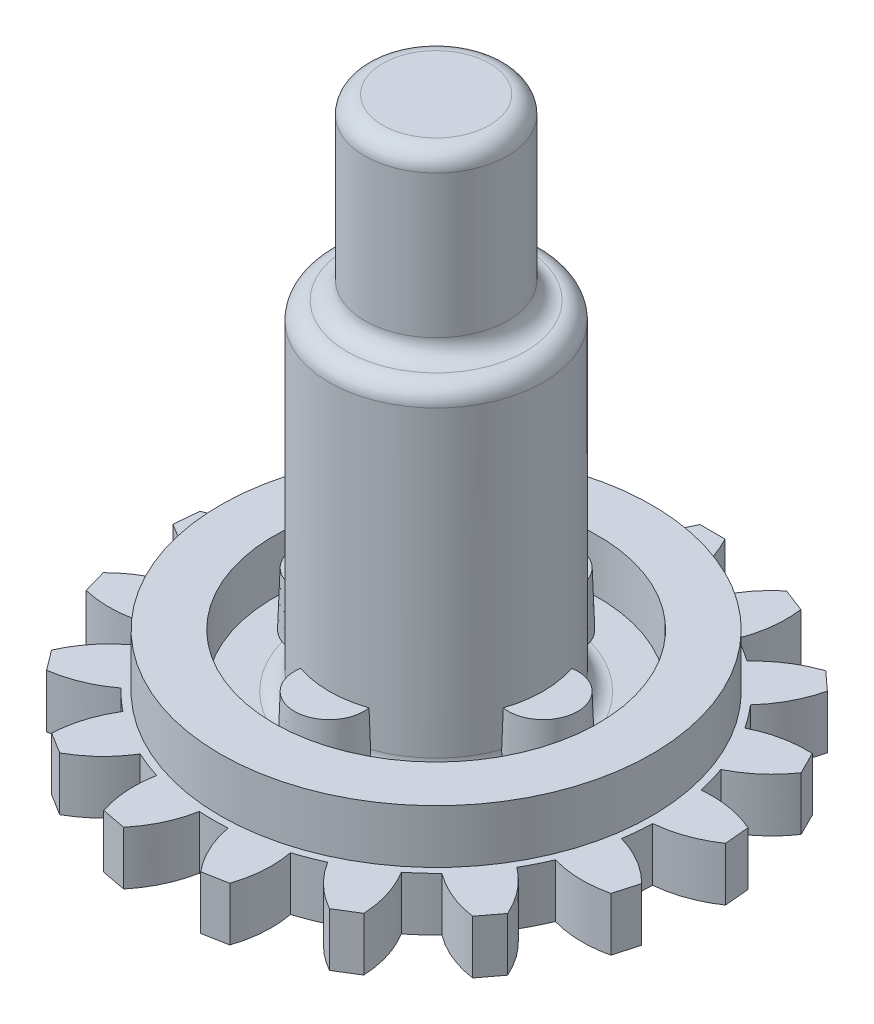
from build123d import *

# Parameters (mm, degrees)
SKETCH2_R                     = 8.9
BOSS_EXTRUDE1_DEPTH           = 1.5
SKETCH3_R                     = 12.1
SKETCH3_R_2                   = 9.1
BOSS_EXTRUDE2_DEPTH           = 3
SKETCH4_R                     = 8.9
BOSS_EXTRUDE3_DEPTH           = 3
SKETCH5_R                     = 2.05
BOSS_EXTRUDE4_DEPTH           = 3
BOSS_EXTRUDE4_DRAFT           = 2
BOSS_EXTRUDE4_PROFILE_2_DEPTH = 3
BOSS_EXTRUDE4_PROFILE_2_DRAFT = 2
BOSS_EXTRUDE4_PROFILE_3_DEPTH = 3
BOSS_EXTRUDE4_PROFILE_3_DRAFT = 2
BOSS_EXTRUDE4_PROFILE_4_DEPTH = 3
BOSS_EXTRUDE4_PROFILE_4_DRAFT = 2
SKETCH6_R                     = 6
BOSS_EXTRUDE5_DEPTH           = 19
SKETCH7_R                     = 4
BOSS_EXTRUDE6_DEPTH           = 10
FILLET1_R                     = 1


with BuildPart() as part:
    # Sketch2 → Boss-Extrude1 (new, symmetric)
    with BuildSketch(Plane(origin=(0, 0, 0), x_dir=(1, 0, 0), z_dir=(0, 1, 0))):
        with BuildLine():
            Line((-0.7, 15.5), (0.7, 15.5))
            add(Edge.make_bspline(
                [(0.7, 15.5), (1.496850228, 14.057355909), (1.5, 12.409673646)],
                knots=[0, 0, 0, 1, 1, 1], degree=2))
            ThreePointArc((1.5, 12.409673646), (2.296868973, 12.287163746), (3.084182841, 12.11353855))
            add(Edge.make_bspline(
                [(4.946515265, 14.706188722), (3.682331401, 13.648818674), (3.084182841, 12.11353855)],
                knots=[0, 0, 0, 1, 1, 1], degree=2))
            Line((4.946515265, 14.706188722), (6.251976386, 14.200450389))
            add(Edge.make_bspline(
                [(6.251976386, 14.200450389), (6.47387394, 12.567369333), (5.881599529, 11.029813552)],
                knots=[0, 0, 0, 1, 1, 1], degree=2))
            ThreePointArc((5.881599529, 11.029813552), (6.580402036, 10.627714197), (7.251829699, 10.18140295))
            add(Edge.make_bspline(
                [(9.924976234, 11.926225167), (8.364193771, 11.396932847), (7.251829699, 10.18140295)],
                knots=[0, 0, 0, 1, 1, 1], degree=2))
            Line((9.924976234, 11.926225167), (10.959588719, 10.983051266))
            add(Edge.make_bspline(
                [(10.959588719, 10.983051266), (10.576565103, 9.380089891), (9.46885645, 8.160316019)],
                knots=[0, 0, 0, 1, 1, 1], degree=2))
            ThreePointArc((9.46885645, 8.160316019), (9.975215341, 7.532932955), (10.440076772, 6.874212464))
            add(Edge.make_bspline(
                [(13.563014167, 7.535558818), (11.916425423, 7.605828086), (10.440076772, 6.874212464)],
                knots=[0, 0, 0, 1, 1, 1], degree=2))
            Line((13.563014167, 7.535558818), (14.187047865, 6.282330211))
            add(Edge.make_bspline(
                [(14.187047865, 6.282330211), (13.250832542, 4.925977332), (11.777291839, 4.18872259)],
                knots=[0, 0, 0, 1, 1, 1], degree=2))
            ThreePointArc((11.777291839, 4.18872259), (12.02282054, 3.420787376), (12.218333627, 2.638621493))
            add(Edge.make_bspline(
                [(15.369291881, 2.127173495), (13.859277792, 2.787514097), (12.218333627, 2.638621493)],
                knots=[0, 0, 0, 1, 1, 1], degree=2))
            Line((15.369291881, 2.127173495), (15.498467584, 0.733145648))
            add(Edge.make_bspline(
                [(15.498467584, 0.733145648), (14.135501622, -0.193415761), (12.495138705, -0.348581036)],
                knots=[0, 0, 0, 1, 1, 1], degree=2))
            ThreePointArc((12.495138705, -0.348581036), (12.446677204, -1.153354493), (12.346436821, -1.953329931))
            add(Edge.make_bspline(
                [(15.099861562, -3.568498396), (13.930357897, -2.407269117), (12.346436821, -1.953329931)],
                knots=[0, 0, 0, 1, 1, 1], degree=2))
            Line((15.099861562, -3.568498396), (14.716733376, -4.915054296))
            add(Edge.make_bspline(
                [(14.716733376, -4.915054296), (13.111092879, -5.286686984), (11.525447851, -4.838806861)],
                knots=[0, 0, 0, 1, 1, 1], degree=2))
            ThreePointArc((11.525447851, -4.838806861), (11.189541142, -5.571729447), (10.807085309, -6.281473324))
            add(Edge.make_bspline(
                [(12.791111268, -8.782224805), (12.120065978, -7.276937298), (10.807085309, -6.281473324)],
                knots=[0, 0, 0, 1, 1, 1], degree=2))
            Line((12.791111268, -8.782224805), (11.947422777, -9.899448923))
            add(Edge.make_bspline(
                [(11.947422777, -9.899448923), (10.315958392, -9.665961835), (8.9991814, -8.675525006)],
                knots=[0, 0, 0, 1, 1, 1], degree=2))
            ThreePointArc((8.9991814, -8.675525006), (8.421195546, -9.237611465), (7.808177042, -9.761268938))
            add(Edge.make_bspline(
                [(8.75485052, -12.80986309), (8.672891989, -11.163814774), (7.808177042, -9.761268938)],
                knots=[0, 0, 0, 1, 1, 1], degree=2))
            Line((8.75485052, -12.80986309), (7.56454653, -13.546868118))
            add(Edge.make_bspline(
                [(7.56454653, -13.546868118), (6.127596562, -12.73979498), (5.257525634, -11.340565427)],
                knots=[0, 0, 0, 1, 1, 1], degree=2))
            ThreePointArc((5.257525634, -11.340565427), (4.515520827, -11.655902868), (3.754731198, -11.922751093))
            add(Edge.make_bspline(
                [(3.536198696, -15.107458383), (4.054395878, -13.542957203), (3.754731198, -11.922751093)],
                knots=[0, 0, 0, 1, 1, 1], degree=2))
            Line((3.536198696, -15.107458383), (2.160036356, -15.364707708))
            add(Edge.make_bspline(
                [(2.160036356, -15.364707708), (1.111668862, -14.093048219), (0.805811899, -12.473999647)],
                knots=[0, 0, 0, 1, 1, 1], degree=2))
            ThreePointArc((0.805811899, -12.473999647), (0, -12.5), (-0.805811899, -12.473999647))
            add(Edge.make_bspline(
                [(-2.160036356, -15.364707708), (-1.111668862, -14.093048219), (-0.805811899, -12.473999647)],
                knots=[0, 0, 0, 1, 1, 1], degree=2))
            Line((-2.160036356, -15.364707708), (-3.536198696, -15.107458383))
            add(Edge.make_bspline(
                [(-3.536198696, -15.107458383), (-4.054395878, -13.542957203), (-3.754731198, -11.922751093)],
                knots=[0, 0, 0, 1, 1, 1], degree=2))
            ThreePointArc((-3.754731198, -11.922751093), (-4.515520827, -11.655902868), (-5.257525634, -11.340565427))
            add(Edge.make_bspline(
                [(-7.56454653, -13.546868118), (-6.127596562, -12.73979498), (-5.257525634, -11.340565427)],
                knots=[0, 0, 0, 1, 1, 1], degree=2))
            Line((-7.56454653, -13.546868118), (-8.75485052, -12.80986309))
            add(Edge.make_bspline(
                [(-8.75485052, -12.80986309), (-8.672891989, -11.163814774), (-7.808177042, -9.761268938)],
                knots=[0, 0, 0, 1, 1, 1], degree=2))
            ThreePointArc((-7.808177042, -9.761268938), (-8.421195546, -9.237611465), (-8.9991814, -8.675525006))
            add(Edge.make_bspline(
                [(-11.947422777, -9.899448923), (-10.315958392, -9.665961835), (-8.9991814, -8.675525006)],
                knots=[0, 0, 0, 1, 1, 1], degree=2))
            Line((-11.947422777, -9.899448923), (-12.791111268, -8.782224805))
            add(Edge.make_bspline(
                [(-12.791111268, -8.782224805), (-12.120065978, -7.276937298), (-10.807085309, -6.281473324)],
                knots=[0, 0, 0, 1, 1, 1], degree=2))
            ThreePointArc((-10.807085309, -6.281473324), (-11.189541142, -5.571729447), (-11.525447851, -4.838806861))
            add(Edge.make_bspline(
                [(-14.716733376, -4.915054296), (-13.111092879, -5.286686984), (-11.525447851, -4.838806861)],
                knots=[0, 0, 0, 1, 1, 1], degree=2))
            Line((-14.716733376, -4.915054296), (-15.099861562, -3.568498396))
            add(Edge.make_bspline(
                [(-15.099861562, -3.568498396), (-13.930357897, -2.407269117), (-12.346436821, -1.953329931)],
                knots=[0, 0, 0, 1, 1, 1], degree=2))
            ThreePointArc((-12.346436821, -1.953329931), (-12.446677204, -1.153354493), (-12.495138705, -0.348581036))
            add(Edge.make_bspline(
                [(-15.498467584, 0.733145648), (-14.135501622, -0.193415761), (-12.495138705, -0.348581036)],
                knots=[0, 0, 0, 1, 1, 1], degree=2))
            Line((-15.498467584, 0.733145648), (-15.369291881, 2.127173495))
            add(Edge.make_bspline(
                [(-15.369291881, 2.127173495), (-13.859277792, 2.787514097), (-12.218333627, 2.638621493)],
                knots=[0, 0, 0, 1, 1, 1], degree=2))
            ThreePointArc((-12.218333627, 2.638621493), (-12.02282054, 3.420787376), (-11.777291839, 4.18872259))
            add(Edge.make_bspline(
                [(-14.187047865, 6.282330211), (-13.250832542, 4.925977332), (-11.777291839, 4.18872259)],
                knots=[0, 0, 0, 1, 1, 1], degree=2))
            Line((-14.187047865, 6.282330211), (-13.563014167, 7.535558818))
            add(Edge.make_bspline(
                [(-13.563014167, 7.535558818), (-11.916425423, 7.605828086), (-10.440076772, 6.874212464)],
                knots=[0, 0, 0, 1, 1, 1], degree=2))
            ThreePointArc((-10.440076772, 6.874212464), (-9.975215341, 7.532932955), (-9.46885645, 8.160316019))
            add(Edge.make_bspline(
                [(-10.959588719, 10.983051266), (-10.576565103, 9.380089891), (-9.46885645, 8.160316019)],
                knots=[0, 0, 0, 1, 1, 1], degree=2))
            Line((-10.959588719, 10.983051266), (-9.924976234, 11.926225167))
            add(Edge.make_bspline(
                [(-9.924976234, 11.926225167), (-8.364193771, 11.396932847), (-7.251829699, 10.18140295)],
                knots=[0, 0, 0, 1, 1, 1], degree=2))
            ThreePointArc((-7.251829699, 10.18140295), (-6.580402036, 10.627714197), (-5.881599529, 11.029813552))
            add(Edge.make_bspline(
                [(-6.251976386, 14.200450389), (-6.47387394, 12.567369333), (-5.881599529, 11.029813552)],
                knots=[0, 0, 0, 1, 1, 1], degree=2))
            Line((-6.251976386, 14.200450389), (-4.946515265, 14.706188722))
            add(Edge.make_bspline(
                [(-4.946515265, 14.706188722), (-3.682331401, 13.648818674), (-3.084182841, 12.11353855)],
                knots=[0, 0, 0, 1, 1, 1], degree=2))
            ThreePointArc((-3.084182841, 12.11353855), (-2.296868973, 12.287163746), (-1.5, 12.409673646))
            add(Edge.make_bspline(
                [(-0.7, 15.5), (-1.496850228, 14.057355909), (-1.5, 12.409673646)],
                knots=[0, 0, 0, 1, 1, 1], degree=2))
        make_face()
        with Locations(Location((0, 0, 0), (0, 0, 270))):
            Circle(SKETCH2_R, mode=Mode.SUBTRACT)
    extrude(amount=BOSS_EXTRUDE1_DEPTH, both=True)

    # Sketch3 → Boss-Extrude2 (add)
    with BuildSketch(Plane(origin=(0, 1.5, 0), x_dir=(1, 0, 0), z_dir=(0, 1, 0))):
        with Locations(Location((0, 0, 0), (0, 0, 270))):
            Circle(SKETCH3_R)
        with Locations(Location((0, 0, 0), (0, 0, 270))):
            Circle(SKETCH3_R_2, mode=Mode.SUBTRACT)
    extrude(amount=BOSS_EXTRUDE2_DEPTH)

    # Sketch4 → Boss-Extrude3 (add)
    with BuildSketch(Plane.XZ.offset(1.5)):
        Circle(SKETCH4_R)
    extrude(amount=-BOSS_EXTRUDE3_DEPTH)


with BuildPart() as boss_extrude4_tool:
    # Sketch5 → Boss-Extrude4 (with draft: the straight prism first)
    with BuildSketch(Plane(origin=(0, 1.5, 0), x_dir=(1, 0, 0), z_dir=(0, 1, 0))):
        with Locations((-6, 0)):
            Circle(SKETCH5_R)
    extrude(amount=BOSS_EXTRUDE4_DEPTH)
    # Boss-Extrude4: the draft: its side faces are tilted about the plane it starts from
    boss_extrude4_sides = [boss_extrude4_tool.faces().sort_by_distance(p)[0] for p in [
        (-8.05, 3, 0),
    ]]
    draft(boss_extrude4_sides, Plane(origin=(0, 1.5, 0), x_dir=(1, 0, 0), z_dir=(0, 1, 0)), BOSS_EXTRUDE4_DRAFT)


with BuildPart() as part_1:
    add(part.part)

    # Boss-Extrude4: add boss_extrude4_tool
    add(boss_extrude4_tool.part)


with BuildPart() as boss_extrude4_profile_2_tool:
    # Sketch5 → Boss-Extrude4 profile 2 (with draft: the straight prism first)
    with BuildSketch(Plane(origin=(0, 1.5, 0), x_dir=(1, 0, 0), z_dir=(0, 1, 0))):
        with Locations((6, 0)):
            Circle(SKETCH5_R)
    extrude(amount=BOSS_EXTRUDE4_PROFILE_2_DEPTH)
    # Boss-Extrude4 profile 2: the draft: its side faces are tilted about the plane it starts from
    boss_extrude4_profile_2_sides = [boss_extrude4_profile_2_tool.faces().sort_by_distance(p)[0] for p in [
        (3.95, 3, 0),
    ]]
    draft(boss_extrude4_profile_2_sides, Plane(origin=(0, 1.5, 0), x_dir=(1, 0, 0), z_dir=(0, 1, 0)), BOSS_EXTRUDE4_PROFILE_2_DRAFT)


with BuildPart() as part_2:
    add(part_1.part)

    # Boss-Extrude4 profile 2: add boss_extrude4_profile_2_tool
    add(boss_extrude4_profile_2_tool.part)


with BuildPart() as boss_extrude4_profile_3_tool:
    # Sketch5 → Boss-Extrude4 profile 3 (with draft: the straight prism first)
    with BuildSketch(Plane(origin=(0, 1.5, 0), x_dir=(1, 0, 0), z_dir=(0, 1, 0))):
        with Locations((0, -6)):
            Circle(SKETCH5_R)
    extrude(amount=BOSS_EXTRUDE4_PROFILE_3_DEPTH)
    # Boss-Extrude4 profile 3: the draft: its side faces are tilted about the plane it starts from
    boss_extrude4_profile_3_sides = [boss_extrude4_profile_3_tool.faces().sort_by_distance(p)[0] for p in [
        (-2.05, 3, 6),
    ]]
    draft(boss_extrude4_profile_3_sides, Plane(origin=(0, 1.5, 0), x_dir=(1, 0, 0), z_dir=(0, 1, 0)), BOSS_EXTRUDE4_PROFILE_3_DRAFT)


with BuildPart() as part_3:
    add(part_2.part)

    # Boss-Extrude4 profile 3: add boss_extrude4_profile_3_tool
    add(boss_extrude4_profile_3_tool.part)


with BuildPart() as boss_extrude4_profile_4_tool:
    # Sketch5 → Boss-Extrude4 profile 4 (with draft: the straight prism first)
    with BuildSketch(Plane(origin=(0, 1.5, 0), x_dir=(1, 0, 0), z_dir=(0, 1, 0))):
        with Locations((0, 6)):
            Circle(SKETCH5_R)
    extrude(amount=BOSS_EXTRUDE4_PROFILE_4_DEPTH)
    # Boss-Extrude4 profile 4: the draft: its side faces are tilted about the plane it starts from
    boss_extrude4_profile_4_sides = [boss_extrude4_profile_4_tool.faces().sort_by_distance(p)[0] for p in [
        (-2.05, 3, -6),
    ]]
    draft(boss_extrude4_profile_4_sides, Plane(origin=(0, 1.5, 0), x_dir=(1, 0, 0), z_dir=(0, 1, 0)), BOSS_EXTRUDE4_PROFILE_4_DRAFT)


with BuildPart() as part_4:
    add(part_3.part)

    # Boss-Extrude4 profile 4: add boss_extrude4_profile_4_tool
    add(boss_extrude4_profile_4_tool.part)

    # Sketch6 → Boss-Extrude5 (add)
    with BuildSketch(Plane(origin=(0, 1.5, 0), x_dir=(1, 0, 0), z_dir=(0, 1, 0))):
        with Locations(Location((0, 0, 0), (0, 0, 108.65798235))):
            Circle(SKETCH6_R)
    extrude(amount=BOSS_EXTRUDE5_DEPTH)

    # Sketch7 → Boss-Extrude6 (add)
    with BuildSketch(Plane(origin=(0, 20.5, 0), x_dir=(1, 0, 0), z_dir=(0, 1, 0))):
        with Locations(Location((0, 0, 0), (0, 0, 270))):
            Circle(SKETCH7_R)
    extrude(amount=BOSS_EXTRUDE6_DEPTH)

    # Fillet1
    # the kernel refuses this fillet: 1 mm, written as the material it adds along each edge
    with BuildSketch(Plane(origin=(0, 1.5, 0), x_dir=(-0.9973097070622594, 0, -0.07330312544080338), z_dir=(0.07330312544080338, 0, -0.9973097070622594))) as fillet1_piece_1:
        with BuildLine():
            CenterArc((6 + FILLET1_R, FILLET1_R), FILLET1_R, 180, 90)
            Line((6, FILLET1_R), (6, 0))
            Line((6, 0), (6 + FILLET1_R, 0))
        make_face()
    revolve(axis=Axis((0, 1.5, 0), (0, 1, 0)), revolution_arc=98.407460289)
    with BuildSketch(Plane(origin=(0, 1.5, 0), x_dir=(-0.0733031254408028, 0, 0.9973097070622595), z_dir=(-0.9973097070622595, 0, -0.0733031254408028))) as fillet1_piece_2:
        with BuildLine():
            CenterArc((6 + FILLET1_R, FILLET1_R), FILLET1_R, 180, 90)
            Line((6, FILLET1_R), (6, 0))
            Line((6, 0), (6 + FILLET1_R, 0))
        make_face()
    revolve(axis=Axis((0, 1.5, 0), (0, 1, 0)), revolution_arc=98.407460289)
    with BuildSketch(Plane(origin=(0, 1.5, 0), x_dir=(0.9973097070622593, 0, 0.07330312544080635), z_dir=(-0.07330312544080635, 0, 0.9973097070622593))) as fillet1_piece_3:
        with BuildLine():
            CenterArc((6 + FILLET1_R, FILLET1_R), FILLET1_R, 180, 90)
            Line((6, FILLET1_R), (6, 0))
            Line((6, 0), (6 + FILLET1_R, 0))
        make_face()
    revolve(axis=Axis((0, 1.5, 0), (0, 1, 0)), revolution_arc=98.407460289)
    with BuildSketch(Plane(origin=(0, 1.5, 0), x_dir=(0.07330312544080338, 0, -0.9973097070622594), z_dir=(0.9973097070622594, 0, 0.07330312544080338))) as fillet1_piece_4:
        with BuildLine():
            CenterArc((6 + FILLET1_R, FILLET1_R), FILLET1_R, 180, 90)
            Line((6, FILLET1_R), (6, 0))
            Line((6, 0), (6 + FILLET1_R, 0))
        make_face()
    revolve(axis=Axis((0, 1.5, 0), (0, 1, 0)), revolution_arc=98.407460289)
    with BuildSketch(Plane(origin=(0, 20.5, 0), x_dir=(0, 0, 1), z_dir=(-1, 0, 0))) as fillet1_piece_5:
        with BuildLine():
            CenterArc((4 + FILLET1_R, FILLET1_R), FILLET1_R, 180, 90)
            Line((4, FILLET1_R), (4, 0))
            Line((4, 0), (4 + FILLET1_R, 0))
        make_face()
    revolve(axis=Axis((0, 20.5, 0), (0, 1, 0)))
    # the kernel refuses this fillet: 1 mm, written as the material it takes off along each edge
    with BuildSketch(Plane(origin=(0, 20.5, 0), x_dir=(-0.3199182712485805, 0, -0.9474451433836788), z_dir=(0.9474451433836788, 0, -0.3199182712485805))) as fillet1_2_piece_1:
        with BuildLine():
            CenterArc((6 - FILLET1_R, -FILLET1_R), FILLET1_R, 0, 90)
            Line((6 - FILLET1_R, 0), (6, 0))
            Line((6, 0), (6, -FILLET1_R))
        make_face()
    revolve(axis=Axis((0, 20.5, 0), (0, 1, 0)), mode=Mode.SUBTRACT)
    with BuildSketch(Plane(origin=(0, 30.5, 0), x_dir=(0, 0, 1), z_dir=(-1, 0, 0))) as fillet1_2_piece_2:
        with BuildLine():
            CenterArc((4 - FILLET1_R, -FILLET1_R), FILLET1_R, 0, 90)
            Line((4 - FILLET1_R, 0), (4, 0))
            Line((4, 0), (4, -FILLET1_R))
        make_face()
    revolve(axis=Axis((0, 30.5, 0), (0, 1, 0)), mode=Mode.SUBTRACT)


solid = part_4.part
